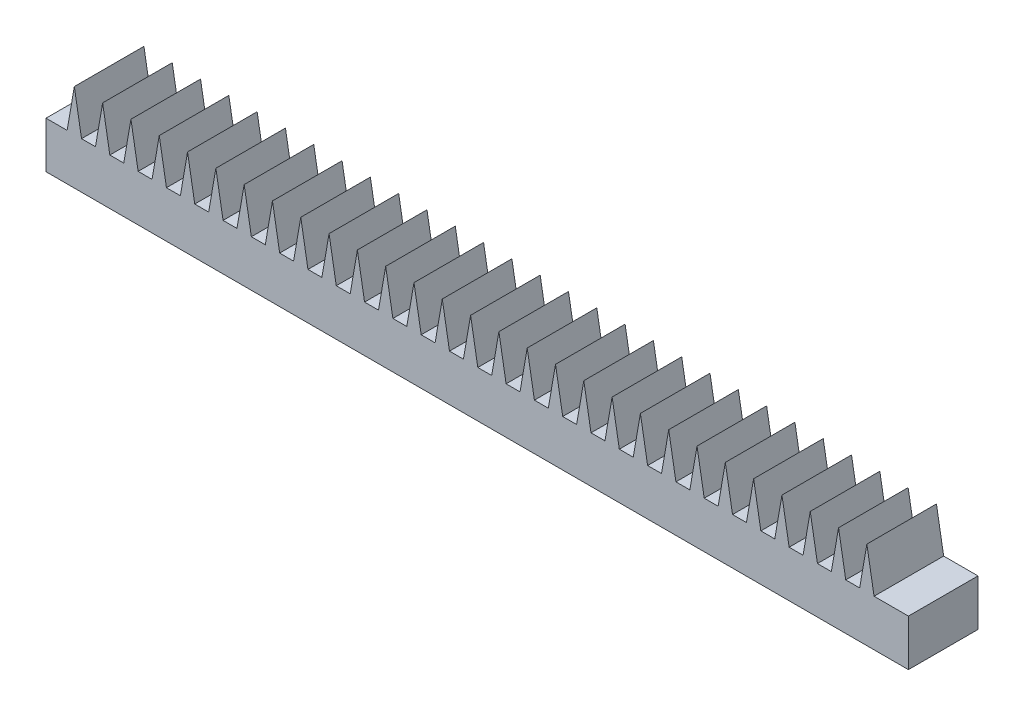
from build123d import *

# Parameters (mm, degrees)
BOSS_EXTRUDE1_DEPTH = 1.5


with BuildPart() as part:
    # Sketch1 → Boss-Extrude1 (new body)
    with BuildSketch(Plane.XY):
        Polygon((-9.619835675, 0), (-9.319835675, 0), (-9.164835675, 0.896110595), (-9.009835675, 0), (-8.709835675, 0), (-8.554835675, 0.896110595), (-8.399835675, 0), (-8.099835675, 0), (-7.944835675, 0.896110595), (-7.789835675, 0), (-7.489835675, 0), (-7.334835675, 0.896110595), (-7.179835675, 0), (-6.879835675, 0), (-6.724835675, 0.896110595), (-6.569835675, 0), (-6.269835675, 0), (-6.114835675, 0.896110595), (-5.959835675, 0), (-5.659835675, 0), (-5.504835675, 0.896110595), (-5.349835675, 0), (-5.049835675, 0), (-4.894835675, 0.896110595), (-4.739835675, 0), (-4.439835675, 0), (-4.284835675, 0.896110595), (-4.129835675, 0), (-3.829835675, 0), (-3.674835675, 0.896110595), (-3.519835675, 0), (-3.219835675, 0), (-3.064835675, 0.896110595), (-2.909835675, 0), (-2.609835675, 0), (-2.454835675, 0.896110595), (-2.299835675, 0), (-1.999835675, 0), (-1.844835675, 0.896110595), (-1.689835675, 0), (-1.389835675, 0), (-1.234835675, 0.896110595), (-1.079835675, 0), (-0.779835675, 0), (-0.624835675, 0.896110595), (-0.469835675, 0), (-0.169835675, 0), (-0.014835675, 0.896110595), (0.140164325, 0), (0.440164325, 0), (0.595164325, 0.896110595), (0.750164325, 0), (1.050164325, 0), (1.205164325, 0.896110595), (1.360164325, 0), (1.660164325, 0), (1.815164325, 0.896110595), (1.970164325, 0), (2.270164325, 0), (2.425164325, 0.896110595), (2.580164325, 0), (2.880164325, 0), (3.035164325, 0.896110595), (3.190164325, 0), (3.490164325, 0), (3.645164325, 0.896110595), (3.800164325, 0), (4.100164325, 0), (4.255164325, 0.896110595), (4.410164325, 0), (4.710164325, 0), (4.865164325, 0.896110595), (5.020164325, 0), (5.320164325, 0), (5.475164325, 0.896110595), (5.630164325, 0), (5.930164325, 0), (6.085164325, 0.896110595), (6.240164325, 0), (6.540164325, 0), (6.695164325, 0.896110595), (6.850164325, 0), (7.150164325, 0), (7.305164325, 0.896110595), (7.460164325, 0), (7.760164325, 0), (7.915164325, 0.896110595), (8.070164325, 0), (8.370164325, 0), (8.8105899, 0), (8.8105899, -1), (-9.775508424, -1), (-9.775508424, 0), align=None)
    extrude(amount=BOSS_EXTRUDE1_DEPTH)


solid = part.part
